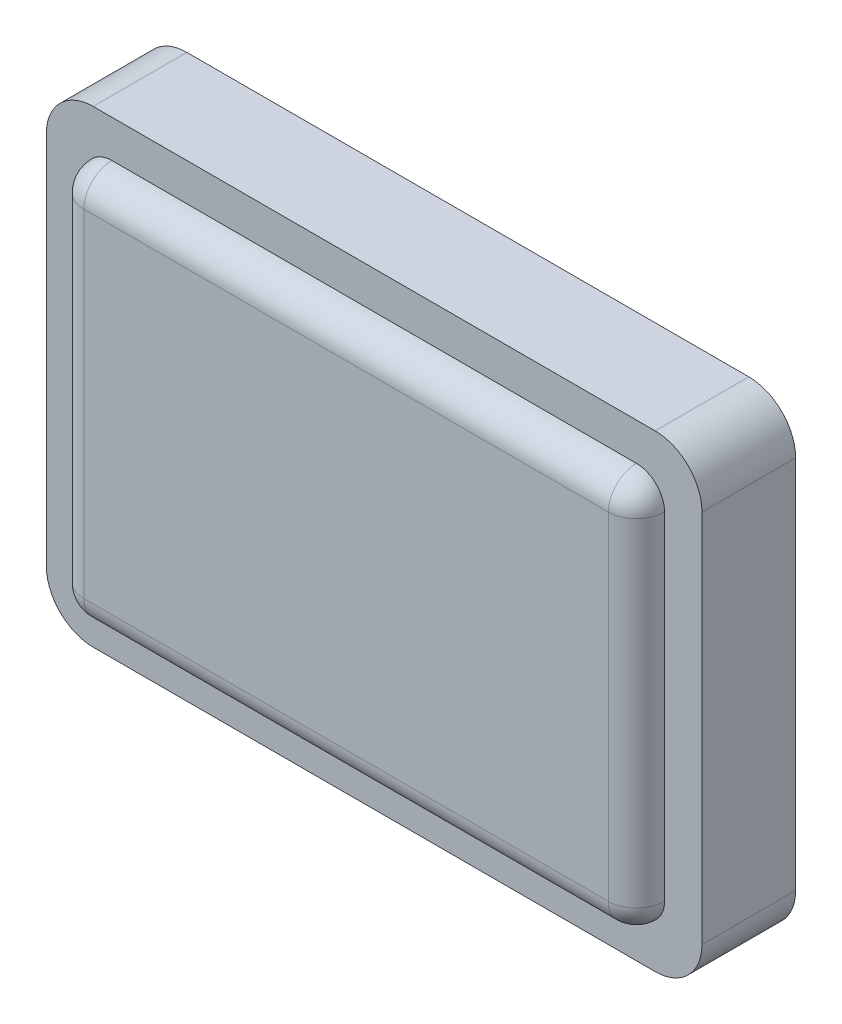
from build123d import *

# Parameters (mm, degrees)
SKETCH_1_W      = 7
SKETCH_1_H      = 5
EXTRUDE_1_DEPTH = 1
FILLET_1_R      = 0.5
SKETCH_2_W      = 6.2
SKETCH_2_H      = 4.2
EXTRUDE_2_DEPTH = 0.3
FILLET_2_R      = 0.3


with BuildPart() as part:
    # Эскиз1 → Бобышка-Вытянуть1 (new body)
    with BuildSketch(Plane.XY):
        Rectangle(SKETCH_1_W, SKETCH_1_H)
    extrude(amount=EXTRUDE_1_DEPTH)

    # Скругление1
    fillet_1_edges = [part.edges().sort_by_distance(p)[0] for p in [
        (3.5, -2.5, 0.5),
        (-3.5, -2.5, 0.5),
        (-3.5, 2.5, 0.5),
        (3.5, 2.5, 0.5),
    ]]
    fillet(fillet_1_edges, radius=FILLET_1_R)

    # Эскиз2 → Бобышка-Вытянуть2 (add)
    with BuildSketch(Plane.XY.offset(1)):
        Rectangle(SKETCH_2_W, SKETCH_2_H)
    extrude(amount=EXTRUDE_2_DEPTH)

    # Скругление2
    fillet_2_edges = [part.edges().sort_by_distance(p)[0] for p in [
        (3.1, -2.1, 1.15),
        (3.1, 2.1, 1.15),
        (-3.1, 2.1, 1.15),
        (-3.1, -2.1, 1.15),
        (3.1, 0, 1.3),
        (0, 2.1, 1.3),
        (-3.1, 0, 1.3),
        (0, -2.1, 1.3),
    ]]
    fillet(fillet_2_edges, radius=FILLET_2_R - 0.0001)  # a hair under: the kernel refuses the full size


solid = part.part
